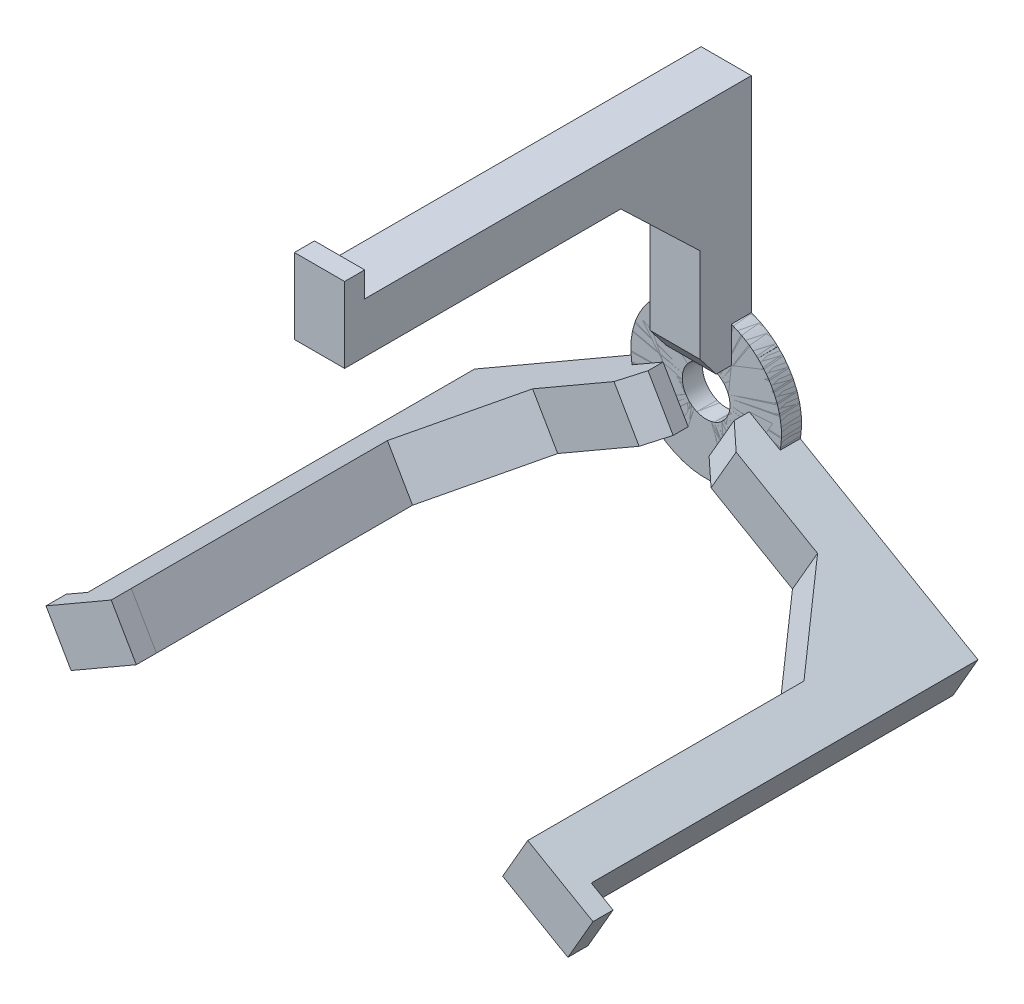
from build123d import *

# Parameters (mm, degrees)
SKETCH1_R                = 4.75
BOSS_EXTRUDE1_DEPTH      = 4
BOSS_EXTRUDE3_DEPTH      = 3
BOSS_EXTRUDE3_DEPTH_BACK = 2
SKETCH2_W                = 10
SKETCH2_H                = 3.269716928
SKETCH6_W                = 10
SKETCH6_H                = 15
BOSS_EXTRUDE4_DEPTH      = 4
BOSS_EXTRUDE5_DEPTH      = 10
CIRPATTERN1_COUNT        = 3
SKETCH11_W               = 3
SKETCH11_H               = 7.760490082
CUT_EXTRUDE3_DEPTH       = 2


with BuildPart() as part:
    # Sketch1 → Boss-Extrude1 (new body)
    with BuildSketch(Plane.XY):
        with BuildLine():
            Line((10.293556018, 10.910669297), (-10.293556018, 10.910669297))
            ThreePointArc((-10.293556018, 10.910669297), (-5.941239758, -13.773222939), (15, 0))
            ThreePointArc((15, 0), (13.773222939, 5.941239758), (10.293556018, 10.910669297))
        make_face()
        Circle(SKETCH1_R, mode=Mode.SUBTRACT)
    extrude(amount=BOSS_EXTRUDE1_DEPTH)

    # Sketch2 → Boss-Extrude3 (add, two sides: drawn at the far end of the back side and taken through both)
    with BuildSketch(Plane.XY.offset(4).offset(-BOSS_EXTRUDE3_DEPTH_BACK)):
        with Locations((0, 8.652125422)):
            Rectangle(SKETCH2_W, SKETCH2_H)
    extrude(amount=BOSS_EXTRUDE3_DEPTH + BOSS_EXTRUDE3_DEPTH_BACK)



with BuildPart() as body_2:
    # Sketch6 → Boss-Extrude4 (new body)
    with BuildSketch(Plane.XY.offset(81)):
        with Locations((0, 52.5)):
            Rectangle(SKETCH6_W, SKETCH6_H)
    extrude(amount=-BOSS_EXTRUDE4_DEPTH)


with BuildPart() as part_1:
    add(part.part)

    add(body_2.part)  # Boss-Extrude5 merges body 2
    # Sketch7 → Boss-Extrude5 (add)
    with BuildSketch(Plane.ZY.offset(5)):
        Polygon((77, 44.999945801), (25.995072649, 44.999945801), (10.189717929, 29.874391285), (10.189717929, 11.156885374), (7, 7.017266958), (0, 7.017266958), (0, 10.910669297), (0, 54.999945801), (77, 54.999945801), align=None)
    extrude(amount=-BOSS_EXTRUDE5_DEPTH)


with BuildPart() as cirpattern1_1:
    # CirPattern1: pattern copy
    add(part_1.part.rotate(Axis((0, 0, 4), (0, 0, 1)), 1 * 360 / CIRPATTERN1_COUNT))


with BuildPart() as cirpattern1_2:
    # CirPattern1: pattern copy
    add(part_1.part.rotate(Axis((0, 0, 4), (0, 0, 1)), 2 * 360 / CIRPATTERN1_COUNT))


with BuildPart() as cut_extrude3_tool:
    # Sketch11 → Cut-Extrude3 (new body)
    with BuildSketch(Plane(origin=(0, 0, 0), x_dir=(-1, 0, 0), z_dir=(0, 0, -1))):
        with Locations((0, 11.618860852)):
            Rectangle(SKETCH11_W, SKETCH11_H)
    extrude(amount=-CUT_EXTRUDE3_DEPTH)


with BuildPart() as part_2:
    add(part_1.part)

    # Cut-Extrude3: cut by cut_extrude3_tool
    add(cut_extrude3_tool.part, mode=Mode.SUBTRACT)


with BuildPart() as cirpattern1_1_1:
    add(cirpattern1_1.part)

    # Cut-Extrude3: cut by cut_extrude3_tool
    add(cut_extrude3_tool.part, mode=Mode.SUBTRACT)


with BuildPart() as cirpattern1_2_1:
    add(cirpattern1_2.part)

    # Cut-Extrude3: cut by cut_extrude3_tool
    add(cut_extrude3_tool.part, mode=Mode.SUBTRACT)


solid = Compound([part_2.part, cirpattern1_1_1.part, cirpattern1_2_1.part])
